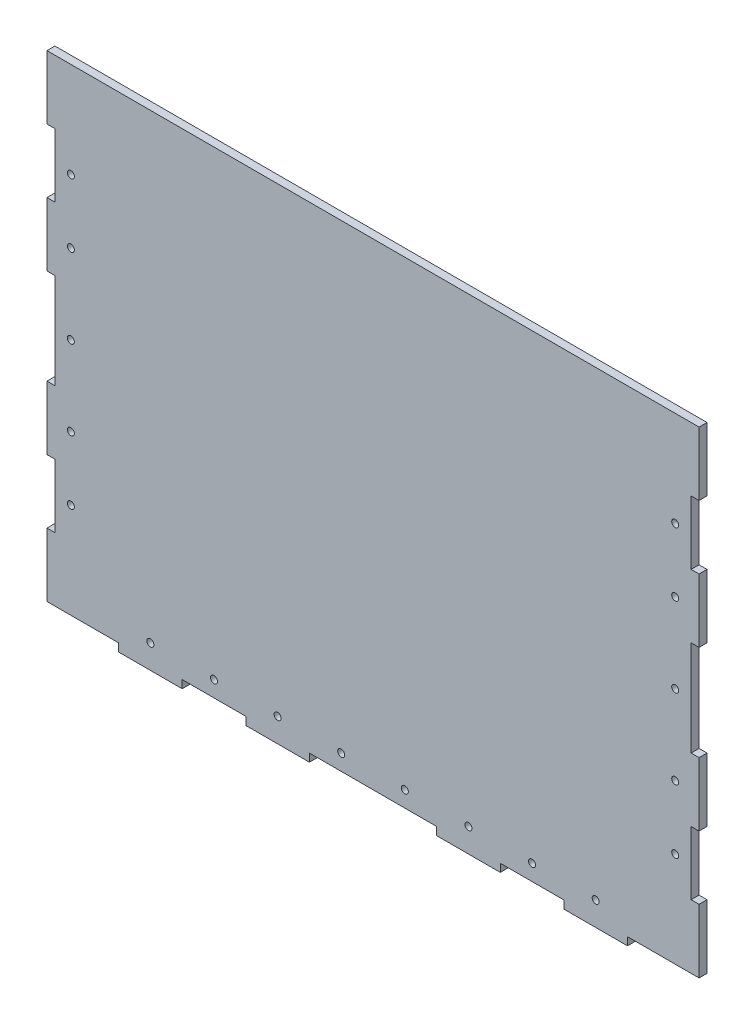
from build123d import *

# Parameters (mm, degrees)
SKETCH_1_R          = 2.2
EXTRUDE_1_DEPTH     = 5
SKETCH_2_W          = 5
SKETCH_2_H          = 220.282443136
SKETCH_2_H_2        = 219.868690955
CUT_EXTRUDE_1_DEPTH = 10
SKETCH_3_W          = 5
SKETCH_3_H          = 40
EXTRUDE_3_DEPTH     = 5
SKETCH_4_W          = 390.4211829
SKETCH_4_H          = 264.690207343
EXTRUDE_4_DEPTH     = 5
SKETCH_5_R          = 2.2
CUT_EXTRUDE_2_DEPTH = 5


with BuildPart() as part:
    # 草图1 → 凸台-拉伸1 (new body)
    with BuildSketch(Plane.XY):
        Polygon((200, 150), (-200, 150), (-200, 110), (-205, 110), (-205, 70), (-200, 70), (-200, 30), (-205, 30), (-205, -30), (-200, -30), (-200, -70), (-205, -70), (-205, -110), (-200, -110), (-200, -150), (-160, -150), (-160, -155), (-120, -155), (-120, -150), (-80, -150), (-80, -155), (-40, -155), (-40, -150), (40, -150), (40, -155), (80, -155), (80, -150), (120, -150), (120, -155), (160, -155), (160, -150), (200, -150), (200, -110), (205, -110), (205, -70), (200, -70), (200, -30), (205, -30), (205, 30), (200, 30), (200, 70), (205, 70), (205, 110), (200, 110), align=None)
        with Locations((-140, -140)):
            Circle(SKETCH_1_R, mode=Mode.SUBTRACT)
        with Locations((-190, -110)):
            Circle(SKETCH_1_R, mode=Mode.SUBTRACT)
        with Locations((-100, -140)):
            Circle(SKETCH_1_R, mode=Mode.SUBTRACT)
        with Locations((-60, -140)):
            Circle(SKETCH_1_R, mode=Mode.SUBTRACT)
        with Locations((-20, -140)):
            Circle(SKETCH_1_R, mode=Mode.SUBTRACT)
        with Locations((-190, -70)):
            Circle(SKETCH_1_R, mode=Mode.SUBTRACT)
        with Locations((-190, -30)):
            Circle(SKETCH_1_R, mode=Mode.SUBTRACT)
        with Locations((20, -140)):
            Circle(SKETCH_1_R, mode=Mode.SUBTRACT)
        with Locations((60, -140)):
            Circle(SKETCH_1_R, mode=Mode.SUBTRACT)
        with Locations((100, -140)):
            Circle(SKETCH_1_R, mode=Mode.SUBTRACT)
        with Locations((140, -140)):
            Circle(SKETCH_1_R, mode=Mode.SUBTRACT)
        with Locations((190, -110)):
            Circle(SKETCH_1_R, mode=Mode.SUBTRACT)
        with Locations((190, -70)):
            Circle(SKETCH_1_R, mode=Mode.SUBTRACT)
        with Locations((190, -30)):
            Circle(SKETCH_1_R, mode=Mode.SUBTRACT)
        with Locations((-190, 30)):
            Circle(SKETCH_1_R, mode=Mode.SUBTRACT)
        with Locations((-190, 70)):
            Circle(SKETCH_1_R, mode=Mode.SUBTRACT)
        with Locations((-190, 110)):
            Circle(SKETCH_1_R, mode=Mode.SUBTRACT)
        with Locations((190, 30)):
            Circle(SKETCH_1_R, mode=Mode.SUBTRACT)
        with Locations((190, 70)):
            Circle(SKETCH_1_R, mode=Mode.SUBTRACT)
        with Locations((190, 110)):
            Circle(SKETCH_1_R, mode=Mode.SUBTRACT)
    extrude(amount=EXTRUDE_1_DEPTH)

    # 草图2 → 切除-拉伸1 (cut)
    with BuildSketch(Plane.XY.offset(5)):
        with Locations((-202.5, -0.141221568)):
            Rectangle(SKETCH_2_W, SKETCH_2_H)
        with Locations((202.5, 0.065654522)):
            Rectangle(SKETCH_2_W, SKETCH_2_H_2)
    extrude(amount=-CUT_EXTRUDE_1_DEPTH, mode=Mode.SUBTRACT)

    # 草图3 → 凸台-拉伸3 (add)
    with BuildSketch(Plane.XY.offset(5)):
        with Locations((-202.5, 130)):
            Rectangle(SKETCH_3_W, SKETCH_3_H)
        with Locations((-202.5, 50)):
            Rectangle(SKETCH_3_W, SKETCH_3_H)
        with Locations((-202.5, -50)):
            Rectangle(SKETCH_3_W, SKETCH_3_H)
        with Locations((-202.5, -130)):
            Rectangle(SKETCH_3_W, SKETCH_3_H)
        with Locations((202.5, -130)):
            Rectangle(SKETCH_3_W, SKETCH_3_H)
        with Locations((202.5, -50)):
            Rectangle(SKETCH_3_W, SKETCH_3_H)
        with Locations((202.5, 50)):
            Rectangle(SKETCH_3_W, SKETCH_3_H)
        with Locations((202.5, 130)):
            Rectangle(SKETCH_3_W, SKETCH_3_H)
    extrude(amount=-EXTRUDE_3_DEPTH)

    # 草图4 → 凸台-拉伸4 (add)
    with BuildSketch(Plane.XY.offset(5)):
        with Locations((1.806920954, 7.46039962)):
            Rectangle(SKETCH_4_W, SKETCH_4_H)
    extrude(amount=-EXTRUDE_4_DEPTH)

    # 草图5 → 切除-拉伸2 (cut)
    with BuildSketch(Plane.XY.offset(5)):
        with Locations((-190, 90)):
            Circle(SKETCH_5_R)
        with Locations((-190, 50)):
            Circle(SKETCH_5_R)
        with Locations((-190, 0)):
            Circle(SKETCH_5_R)
        with Locations((-190, -50)):
            Circle(SKETCH_5_R)
        with Locations((-190, -90)):
            Circle(SKETCH_5_R)
        with Locations((190, -90)):
            Circle(SKETCH_5_R)
        with Locations((190, -50)):
            Circle(SKETCH_5_R)
        with Locations((190, 0)):
            Circle(SKETCH_5_R)
        with Locations((190, 50)):
            Circle(SKETCH_5_R)
        with Locations((190, 90)):
            Circle(SKETCH_5_R)
    extrude(amount=-CUT_EXTRUDE_2_DEPTH, mode=Mode.SUBTRACT)


solid = part.part
